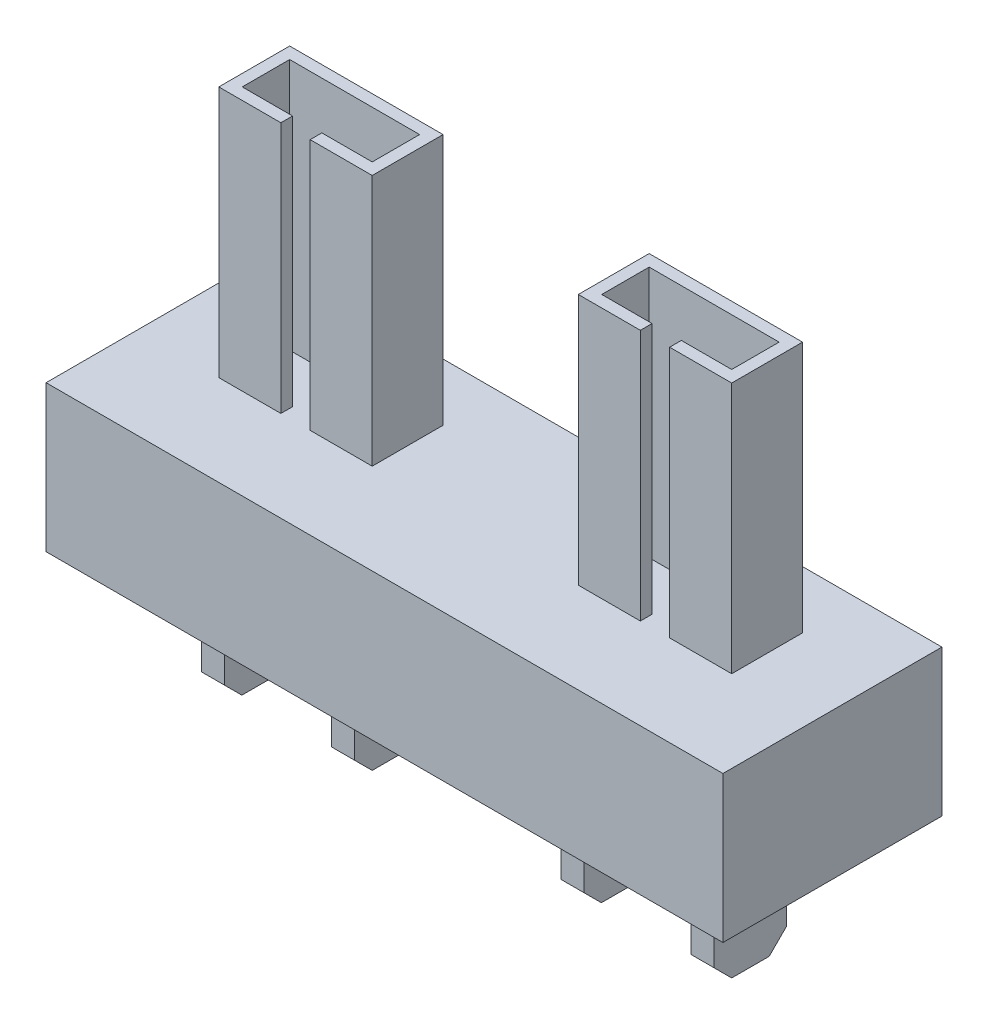
from build123d import *

# Parameters (mm, degrees)
SKETCH1_W           = 14.6812
SKETCH1_H           = 3.175
BOSS_EXTRUDE1_DEPTH = 2.3749
SKETCH2_W           = 0.5
SKETCH2_H           = 1.5748
BOSS_EXTRUDE2_DEPTH = 2.54
CHAMFER1_SIZE       = 0.381
BOSS_EXTRUDE3_DEPTH = 5.461


with BuildPart() as part:
    # Sketch1 → Boss-Extrude1 (new, symmetric)
    with BuildSketch(Plane.XY):
        Rectangle(SKETCH1_W, SKETCH1_H)
    extrude(amount=BOSS_EXTRUDE1_DEPTH, both=True)

    # Sketch2 → Boss-Extrude2 (add)
    with BuildSketch(Plane.XZ.offset(1.5875)):
        with Locations((-5.3122, 0)):
            Rectangle(SKETCH2_W, SKETCH2_H)
        with Locations((-2.4852, 0)):
            Rectangle(SKETCH2_W, SKETCH2_H)
        with Locations((2.4852, 0)):
            Rectangle(SKETCH2_W, SKETCH2_H)
        with Locations((5.3122, 0)):
            Rectangle(SKETCH2_W, SKETCH2_H)
    extrude(amount=BOSS_EXTRUDE2_DEPTH)

    # Chamfer1
    chamfer1_edges = [part.edges().sort_by_distance(p)[0] for p in [
        (-5.3122, -4.1275, -0.7874),
        (-2.4852, -4.1275, -0.7874),
        (2.4852, -4.1275, -0.7874),
        (5.3122, -4.1275, -0.7874),
        (-5.3122, -4.1275, 0.7874),
        (-2.4852, -4.1275, 0.7874),
        (2.4852, -4.1275, 0.7874),
        (5.3122, -4.1275, 0.7874),
    ]]
    chamfer(chamfer1_edges, length=CHAMFER1_SIZE)

    # Sketch3 → Boss-Extrude3 (add)
    with BuildSketch(Plane(origin=(0, 1.5875, 0), x_dir=(1, 0, 0), z_dir=(0, 1, 0))):
        Polygon((-5.3082, 0.8763), (-2.4892, 0.8763), (-2.4892, -0.1524), (-3.5812, -0.1524), (-3.5812, -0.4064), (-2.2352, -0.4064), (-2.2352, 1.1303), (-5.5622, 1.1303), (-5.5622, -0.4064), (-4.2162, -0.4064), (-4.2162, -0.1524), (-5.3082, -0.1524), align=None)
        Polygon((5.5622, 1.1303), (5.5622, -0.4064), (4.2162, -0.4064), (4.2162, -0.1524), (5.3082, -0.1524), (5.3082, 0.8763), (2.4892, 0.8763), (2.4892, -0.1524), (3.5812, -0.1524), (3.5812, -0.4064), (2.2352, -0.4064), (2.2352, 1.1303), align=None)
    extrude(amount=BOSS_EXTRUDE3_DEPTH)


solid = part.part
